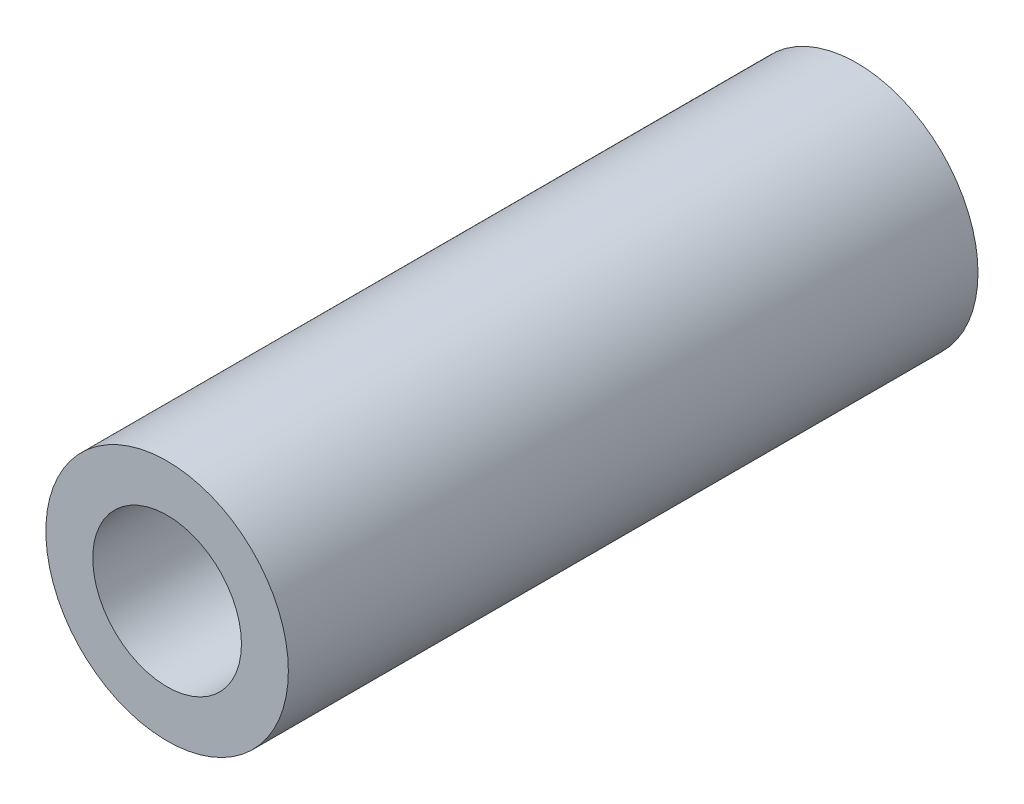
from build123d import *

# Parameters (mm, degrees)
SKETCH1_R           = 6.565
SKETCH1_R_2         = 4.025
BOSS_EXTRUDE1_DEPTH = 37.338


with BuildPart() as part:
    # Sketch1 → Boss-Extrude1 (new body)
    with BuildSketch(Plane.XY):
        Circle(SKETCH1_R)
        Circle(SKETCH1_R_2, mode=Mode.SUBTRACT)
    extrude(amount=BOSS_EXTRUDE1_DEPTH)


solid = part.part
